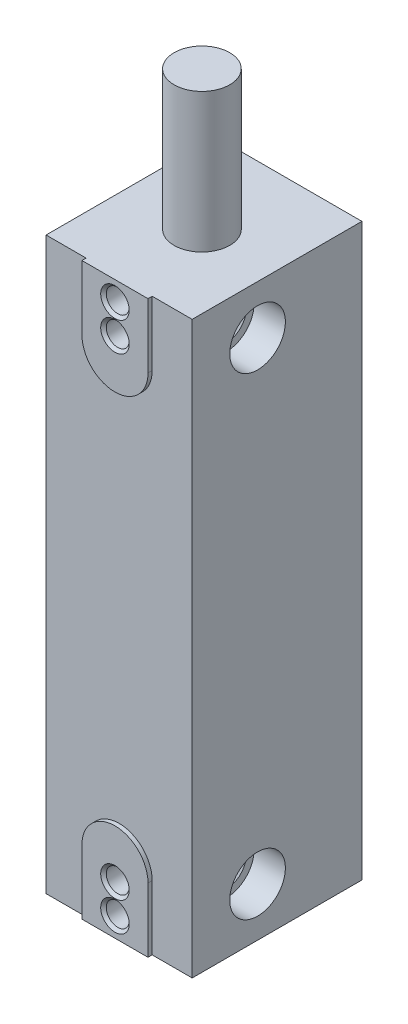
from build123d import *

# Parameters (mm, degrees)
SKETCH_2_W                  = 1
SKETCH_2_H                  = 57.5
EXTRUDE_2_DEPTH             = 8
EXTRUDE_3_DEPTH             = 23
EXTRUDE_3_DEPTH_BACK        = 2
SKETCH_3_W                  = 21
SKETCH_3_H                  = 82
SKETCH_4_R                  = 4
EXTRUDE_4_DEPTH             = 20
SKETCH_5_R                  = 4
CUT_EXTRUDE_1_DEPTH         = 4.5
CUT_EXTRUDE_START           = -4.5
SKETCH_6_R                  = 4
CUT_EXTRUDE_2_DEPTH         = 4.5
HOLE_WIZARD_M51_AT_2_COUNT  = 2
HOLE_WIZARD_M51_AT_2_PITCH  = 68
CUT_EXTRUDE_3_DEPTH         = 0.6
HOLE_WIZARD_M41_D           = 3.3
HOLE_WIZARD_M41_DEPTH       = 6.5
HOLE_WIZARD_M41_CSINK_D     = 4.1
HOLE_WIZARD_M41_CSINK_ANGLE = 90
HOLE_WIZARD_M41_TIP         = 0.991420021
SKETCH_12_W                 = 16.5
SKETCH_12_H                 = 51
CUT_EXTRUDE_4_DEPTH         = 1.5
CHAMFER_1_SIZE              = 1.5


with BuildPart() as part:
    # Эскиз2 → Бобышка-Вытянуть2 (new body)
    with BuildSketch(Plane(origin=(0, 0, 3), x_dir=(-1, 0, 0), z_dir=(0, 0, -1))):
        Rectangle(SKETCH_2_W, SKETCH_2_H)
    extrude(amount=EXTRUDE_2_DEPTH)

    # Эскиз3 → Бобышка-Вытянуть3 (add, two sides: drawn at the far end of the back side and taken through both)
    with BuildSketch(Plane.XY.offset(3).offset(-EXTRUDE_3_DEPTH_BACK)):
        Rectangle(SKETCH_3_W, SKETCH_3_H)
    extrude(amount=EXTRUDE_3_DEPTH + EXTRUDE_3_DEPTH_BACK)

    # Эскиз4 → Бобышка-Вытянуть4 (add)
    with BuildSketch(Plane(origin=(0, 41, 0), x_dir=(1, 0, 0), z_dir=(0, 1, 0))):
        with Locations(Location((0, -13.5, 0), (0, 0, 270))):
            Circle(SKETCH_4_R)
    extrude(amount=EXTRUDE_4_DEPTH)

    # Эскиз5 → Вырез-Вытянуть1 (cut)
    with BuildSketch(Plane.ZY.offset(10.5)):
        with Locations((16, 34)):
            Circle(SKETCH_5_R)
        with Locations(Location((16, -34, 0), (0, 0, 180))):
            Circle(SKETCH_5_R)
    extrude(amount=-CUT_EXTRUDE_1_DEPTH, mode=Mode.SUBTRACT)

    # Эскиз6 → Вырез-Вытянуть2 (cut)
    with BuildSketch(Plane(origin=(10.5, 0, 0), x_dir=(0, 0, -1), z_dir=(1, 0, 0)).offset(CUT_EXTRUDE_START)):
        with Locations(Location((-16, 34, 0), (0, 0, 180))):
            Circle(SKETCH_6_R)
        with Locations((-16, -34)):
            Circle(SKETCH_6_R)
    extrude(amount=CUT_EXTRUDE_2_DEPTH, mode=Mode.SUBTRACT)

    # Эскиз8 → Отверстие обработанное метчиком M51 (revolve, cut)
    with BuildSketch(Plane(origin=(6, 34, 16), x_dir=(0, 0, -1), z_dir=(0, 1, 0))):
        Polygon((0, 0), (0, 12), (2.9, 12), (2.1, 11.2), (2.1, 0.8), (2.9, 0), align=None)
    hole_wizard_m51 = revolve(axis=Axis((12.35, 34, 16), (-1, 0, 0)), mode=Mode.SUBTRACT)

    # Отверстие обработанное метчиком M51 at 2: Отверстие обработанное метчиком M51 ×2
    with Locations(*[(0, -i * HOLE_WIZARD_M51_AT_2_PITCH, 0) for i in range(1, HOLE_WIZARD_M51_AT_2_COUNT)]):
        add(hole_wizard_m51, mode=Mode.SUBTRACT)

    # Эскиз9 → Вырез-Вытянуть3 (cut)
    with BuildSketch(Plane.XY.offset(26)):
        with BuildLine():
            Line((-4.75, 31.75), (-4.75, 41))
            Line((-4.75, 41), (-10.5, 41))
            Line((-10.5, 41), (-10.5, -41))
            Line((-10.5, -41), (-4.75, -41))
            Line((-4.75, -41), (-4.75, -31.75))
            ThreePointArc((-4.75, -31.75), (0, -27), (4.75, -31.75))
            Line((4.75, -31.75), (4.75, -41))
            Line((4.75, -41), (10.5, -41))
            Line((10.5, -41), (10.5, 41))
            Line((10.5, 41), (4.75, 41))
            Line((4.75, 41), (4.75, 31.75))
            ThreePointArc((4.75, 31.75), (0, 27), (-4.75, 31.75))
        make_face()
    extrude(amount=-CUT_EXTRUDE_3_DEPTH, mode=Mode.SUBTRACT)

    # Отверстие обработанное метчиком M41
    with Locations(Plane.XY.offset(26)):
        with Locations((0, 38.2), (0, 34), (0, -34), (0, -38.2)):
            CounterSinkHole(HOLE_WIZARD_M41_D / 2, HOLE_WIZARD_M41_CSINK_D / 2, depth=HOLE_WIZARD_M41_DEPTH, counter_sink_angle=HOLE_WIZARD_M41_CSINK_ANGLE)
            with Locations((0, 0, -(HOLE_WIZARD_M41_DEPTH + HOLE_WIZARD_M41_TIP / 2))):  # 118° drill point
                Cone(0, HOLE_WIZARD_M41_D / 2, HOLE_WIZARD_M41_TIP, mode=Mode.SUBTRACT)

    # Эскиз12 → Вырез-Вытянуть4 (cut)
    with BuildSketch(Plane.ZY.offset(10.5)):
        Polygon((2, 0), (4, 0.932615316), (4, -0.932615316), align=None)
        with Locations((13.25, 0)):
            Rectangle(SKETCH_12_W, SKETCH_12_H)
    extrude(amount=-CUT_EXTRUDE_4_DEPTH, mode=Mode.SUBTRACT)

    # Фаска1
    chamfer_1_edges = [part.edges().sort_by_distance(p)[0] for p in [
        (-9, -25.5, 13.25),
        (-9, 0, 5),
        (-9, 25.5, 13.25),
        (-9, 0, 21.5),
    ]]
    chamfer(chamfer_1_edges, length=CHAMFER_1_SIZE - 0.0001)  # a hair under: the kernel refuses the full size


solid = part.part
